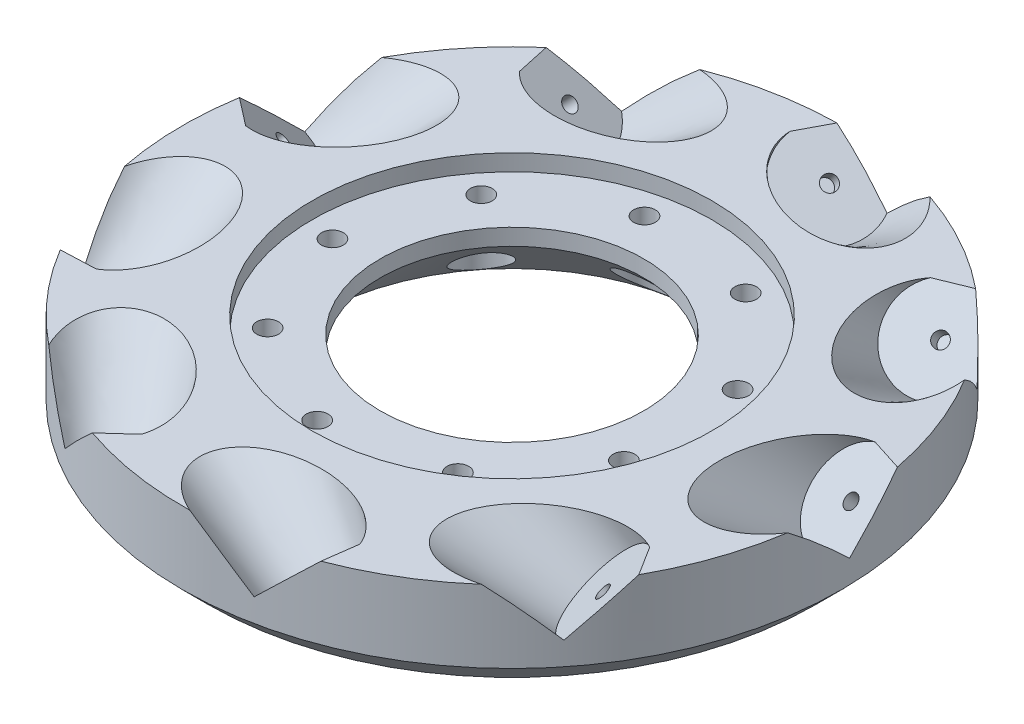
from build123d import *

# Parameters (mm, degrees)
SKETCH_1_R                = 50
EXTRUDE_1_DEPTH           = 15
SKETCH_6_R                = 30.3
CUT_EXTRUDE_3_DEPTH       = 2.5
SKETCH_7_R                = 20
CUT_EXTRUDE_4_DEPTH       = 72.807033082
CHAMFER_3_SIZE            = 4
CHAMFER_4_SIZE            = 10
CUT_EXTRUDE_START         = -6.304091394
CUT_EXTRUDE_13_OUTLINE_R  = 2.059987931
CUT_EXTRUDE_13_DEPTH      = 9.304091394
SKETCH_25_R               = 7
CUT_EXTRUDE_14_DEPTH      = 77.996781834
SKETCH_26_R               = 1.1
CUT_EXTRUDE_15_DEPTH      = 2.5
PATTERN_CIRCULAR_4_COUNT  = 9
PATTERN_CIRCULAR_23_COUNT = 9
SKETCH_32_R               = 1.65
CUT_EXTRUDE_24_DEPTH      = 73.284161612
SKETCH_34_R               = 3.7
CUT_EXTRUDE_25_DEPTH      = 7.6


with BuildPart() as part:
    # 草图1 → 凸台-拉伸1 (new body)
    with BuildSketch(Plane(origin=(0, 0, 0), x_dir=(1, 0, 0), z_dir=(0, 1, 0))):
        with Locations(Location((0, 0, 0), (0, 0, 270))):
            Circle(SKETCH_1_R)
    extrude(amount=EXTRUDE_1_DEPTH)

    # 草图6 → 切除-拉伸3 (cut)
    with BuildSketch(Plane(origin=(0, 15, 0), x_dir=(1, 0, 0), z_dir=(0, 1, 0))):
        with Locations(Location((0, 0, 0), (0, 0, 270))):
            Circle(SKETCH_6_R)
    extrude(amount=-CUT_EXTRUDE_3_DEPTH, mode=Mode.SUBTRACT)

    # 草图7 → 切除-拉伸4 (cut, through all)
    with BuildSketch(Plane(origin=(0, 12.5, 0), x_dir=(1, 0, 0), z_dir=(0, 1, 0))):
        with Locations(Location((0, 0, 0), (0, 0, 270))):
            Circle(SKETCH_7_R)
    extrude(amount=-CUT_EXTRUDE_4_DEPTH, mode=Mode.SUBTRACT)

    # 倒角3
    chamfer_3_edges = [part.edges().sort_by_distance(p)[0] for p in [
        (0, 0, -50),
    ]]
    chamfer(chamfer_3_edges, length=CHAMFER_3_SIZE)

    # 倒角4
    chamfer_4_edges = [part.edges().sort_by_distance(p)[0] for p in [
        (0, 0, -20),
    ]]
    chamfer(chamfer_4_edges, length=CHAMFER_4_SIZE)

    # 切除-拉伸13: read off the stored shape, not the designer's step
    # 切除-拉伸13 outline → 切除-拉伸13 (cut)
    with BuildSketch(Plane(origin=(0, 0, 0), x_dir=(0.7227786767849991, -0.676095009830237, 0.14313113591241258), z_dir=(0.6910795789089168, 0.7071067811865488, -0.14969641149697793)).offset(CUT_EXTRUDE_START)):
        with Locations((-32.494464976, 33.650067849)):
            Circle(CUT_EXTRUDE_13_OUTLINE_R)
    cut_extrude_13 = extrude(amount=CUT_EXTRUDE_13_DEPTH, mode=Mode.SUBTRACT)

    # 草图25 → 切除-拉伸14 (cut, through all)
    with BuildSketch(Plane(origin=(-4.356628844, -4.457665787, 0.943699862), x_dir=(0.7227786763478554, -0.6760950102877349, 0.14313113595884663), z_dir=(0.691079579366112, 0.7071067807715997, -0.149696411346374))):
        with Locations((-32.494464971, 33.65006785)):
            Circle(SKETCH_25_R)
    cut_extrude_14 = extrude(amount=CUT_EXTRUDE_14_DEPTH, mode=Mode.SUBTRACT)

    # 草图26 → 切除-拉伸15 (cut)
    with BuildSketch(Plane(origin=(-4.356628844, -4.457665787, 0.943699862), x_dir=(0.7227786763478554, -0.6760950102877349, 0.14313113595884663), z_dir=(0.691079579366112, 0.7071067807715997, -0.149696411346374))):
        with Locations(Location((-32.494464971, 33.65006785, 0), (0, 0, 188.323515711))):
            Circle(SKETCH_26_R)
    cut_extrude_15 = extrude(amount=-CUT_EXTRUDE_15_DEPTH, mode=Mode.SUBTRACT)

    # 阵列(圆周)4: 切除-拉伸13, 切除-拉伸14, 切除-拉伸15 ×9 about axis
    pattern_circular_4_axis = Axis((-1.1e-08, 0, 0), (0, 1, 0))
    add([cut_extrude_13.rotate(pattern_circular_4_axis, i * 360 / PATTERN_CIRCULAR_4_COUNT) for i in range(1, PATTERN_CIRCULAR_4_COUNT)], mode=Mode.SUBTRACT)
    add([cut_extrude_14.rotate(pattern_circular_4_axis, i * 360 / PATTERN_CIRCULAR_4_COUNT) for i in range(1, PATTERN_CIRCULAR_4_COUNT)], mode=Mode.SUBTRACT)
    add([cut_extrude_15.rotate(pattern_circular_4_axis, i * 360 / PATTERN_CIRCULAR_4_COUNT) for i in range(1, PATTERN_CIRCULAR_4_COUNT)], mode=Mode.SUBTRACT)

    # 切除-放样3: read off the stored shape, not the designer's step
    # 切除-放样3: loft between two sections, ruled curve by curve
    loft_3_from = [
        Edge.make_bspline([(14.660087619, 40.645270495, -43.139375622), (30.517861808, 35.966531275, -63.205276975), (43.164749625, 18.187065611, -49.065021347), (27.306975437, 22.865804831, -28.999119994), (11.449201249, 27.544544052, -8.933218642), (-1.197686569, 45.324009716, -23.073474269), (14.660087619, 40.645270495, -43.139375622)], [0, 0, 0, 0, 0.5, 0.5, 0.5, 1, 1, 1, 1], 3, [1, 0.333333333, 0.333333333, 1, 0.333333333, 0.333333333, 1]),
    ]
    loft_3_to = [
        Edge.make_bspline([(-0.083718903, 14.895412355, -50.9321928), (9.823377273, 10.183423043, -59.629698309), (14.420637954, 1.477266789, -49.676405512), (4.513541778, 6.189256101, -40.978900003), (-5.393554399, 10.901245413, -32.281394495), (-9.99081508, 19.607401667, -42.234687292), (-0.083718903, 14.895412355, -50.9321928)], [0, 0, 0, 0, 0.5, 0.5, 0.5, 1, 1, 1, 1], 3, [1, 0.333333333, 0.333333333, 1, 0.333333333, 0.333333333, 1]),
    ]
    loft_3 = Solid(Shell([*[Face.make_surface_from_curves(loft_3_from[k], loft_3_to[k]) for k in range(1)], Face(Wire(loft_3_from)), Face(Wire(loft_3_to))]))
    add(loft_3, mode=Mode.SUBTRACT)

    # 阵列(圆周)23: 切除-放样3 ×9 about axis
    pattern_circular_23_axis = Axis((0, 15, 0), (0, -1, 0))
    for i in range(1, PATTERN_CIRCULAR_23_COUNT):
        add(loft_3.rotate(pattern_circular_23_axis, i * 360 / PATTERN_CIRCULAR_23_COUNT), mode=Mode.SUBTRACT)

    # 草图32 → 切除-拉伸24 (cut, through all)
    with BuildSketch(Plane(origin=(0, 15, 0), x_dir=(1, 0, 0), z_dir=(0, 1, 0))):
        with Locations(Location((24.300266149, 9.927717013, 0), (0, 0, 270))):
            Circle(SKETCH_32_R)
        with Locations(Location((24.996497338, -8.014837542, 0), (0, 0, 270))):
            Circle(SKETCH_32_R)
        with Locations(Location((13.996589618, -22.207160536, 0), (0, 0, 270))):
            Circle(SKETCH_32_R)
        with Locations(Location((-3.55247794, -26.00850631, 0), (0, 0, 270))):
            Circle(SKETCH_32_R)
        with Locations(Location((-19.439301588, -17.640182929, 0), (0, 0, 270))):
            Circle(SKETCH_32_R)
        with Locations(Location((-26.230259979, -1.017821907, 0), (0, 0, 270))):
            Circle(SKETCH_32_R)
        with Locations(Location((-20.747788209, 16.080789297, 0), (0, 0, 270))):
            Circle(SKETCH_32_R)
        with Locations(Location((-5.55719575, 25.655020471, 0), (0, 0, 270))):
            Circle(SKETCH_32_R)
        with Locations(Location((12.233670361, 23.224982443, 0), (0, 0, 270))):
            Circle(SKETCH_32_R)
    extrude(amount=-CUT_EXTRUDE_24_DEPTH, mode=Mode.SUBTRACT)

    # 草图34 → 切除-拉伸25 (cut)
    with BuildSketch(Plane.XZ):
        with Locations(Location((12.233670361, -23.224982443, 0), (0, 0, 270))):
            Circle(SKETCH_34_R)
        with Locations(Location((-5.55719575, -25.655020471, 0), (0, 0, 270))):
            Circle(SKETCH_34_R)
        with Locations(Location((-20.747788209, -16.080789297, 0), (0, 0, 270))):
            Circle(SKETCH_34_R)
        with Locations(Location((-26.230259979, 1.017821907, 0), (0, 0, 270))):
            Circle(SKETCH_34_R)
        with Locations(Location((-19.439301588, 17.640182929, 0), (0, 0, 270))):
            Circle(SKETCH_34_R)
        with Locations(Location((-3.55247794, 26.00850631, 0), (0, 0, 270))):
            Circle(SKETCH_34_R)
        with Locations(Location((13.996589618, 22.207160536, 0), (0, 0, 270))):
            Circle(SKETCH_34_R)
        with Locations(Location((24.996497338, 8.014837542, 0), (0, 0, 270))):
            Circle(SKETCH_34_R)
        with Locations(Location((24.300266149, -9.927717013, 0), (0, 0, 270))):
            Circle(SKETCH_34_R)
    extrude(amount=-CUT_EXTRUDE_25_DEPTH, mode=Mode.SUBTRACT)


solid = part.part
